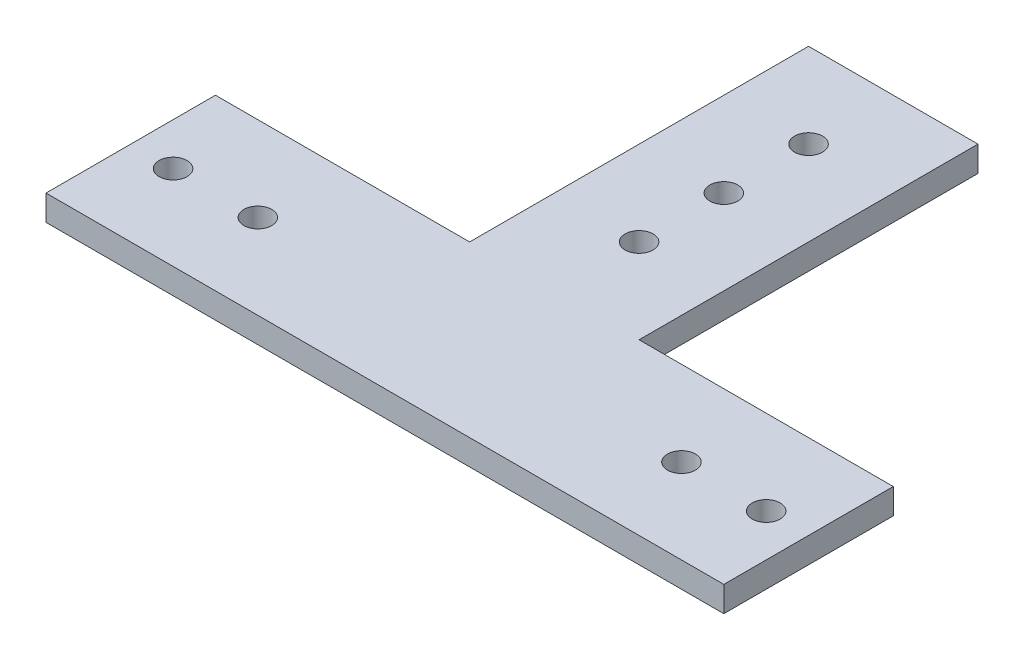
from build123d import *

# Parameters (mm, degrees)
SKETCH_1_R      = 1.65
EXTRUDE_1_DEPTH = 3


with BuildPart() as part:
    # 草图1 → 凸台-拉伸1 (new body)
    with BuildSketch(Plane(origin=(0, 0, 0), x_dir=(1, 0, 0), z_dir=(0, 1, 0))):
        Polygon((-40.334108275, -30.334108275), (39.665891725, -30.334108275), (39.665891725, -10.334108275), (9.665891725, -10.334108275), (9.665891725, 29.665891725), (-10.334108275, 29.665891725), (-10.334108275, -10.334108275), (-40.334108275, -10.334108275), align=None)
        with Locations((-0.334108275, -0.334108275)):
            Circle(SKETCH_1_R, mode=Mode.SUBTRACT)
        with Locations((-0.334108275, 9.665891725)):
            Circle(SKETCH_1_R, mode=Mode.SUBTRACT)
        with Locations((-0.334108275, 19.665891725)):
            Circle(SKETCH_1_R, mode=Mode.SUBTRACT)
        with Locations((-25.334108275, -20.334108275)):
            Circle(SKETCH_1_R, mode=Mode.SUBTRACT)
        with Locations((-35.334108275, -20.334108275)):
            Circle(SKETCH_1_R, mode=Mode.SUBTRACT)
        with Locations((24.665891725, -20.334108275)):
            Circle(SKETCH_1_R, mode=Mode.SUBTRACT)
        with Locations((34.665891725, -20.334108275)):
            Circle(SKETCH_1_R, mode=Mode.SUBTRACT)
    extrude(amount=EXTRUDE_1_DEPTH)


solid = part.part
